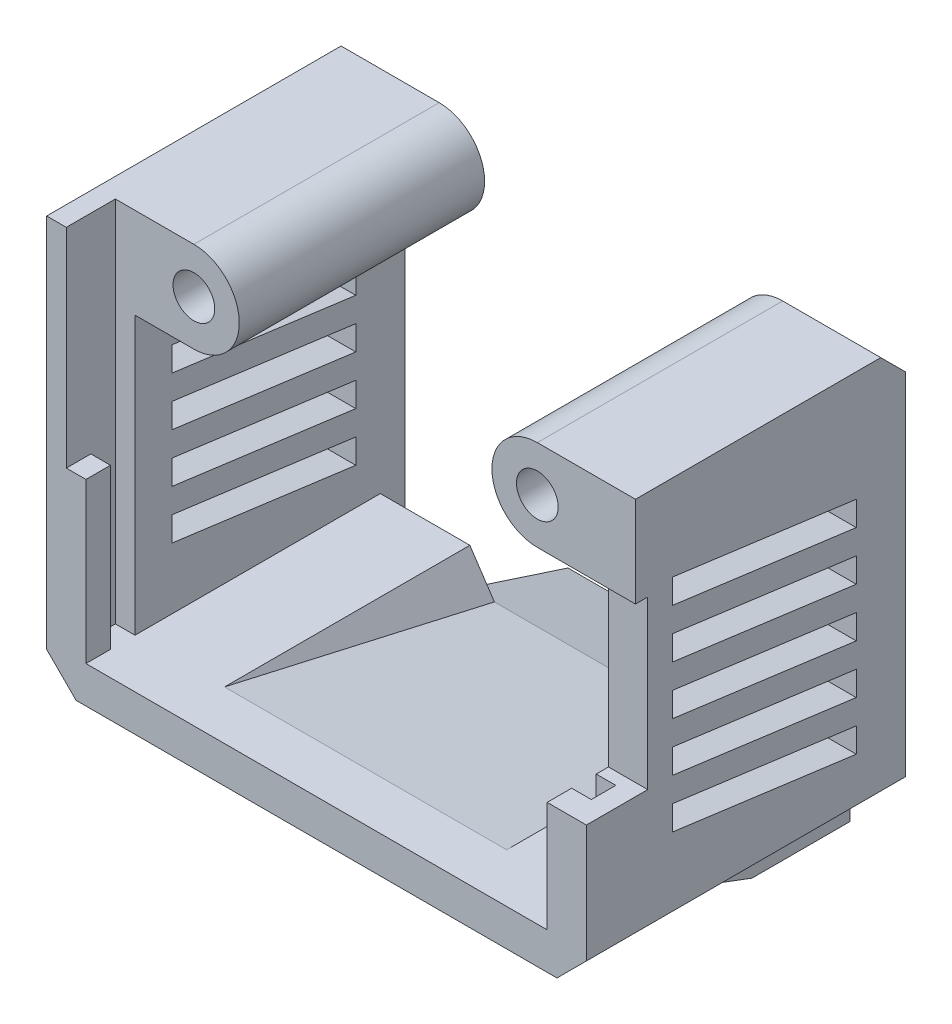
from build123d import *
from OCP.BRepFilletAPI import BRepFilletAPI_MakeChamfer

# Parameters (mm, degrees)
SKETCH_1_W           = 44
SKETCH_1_H           = 34
EXTRUDE_1_DEPTH      = 24
CUT_EXTRUDE_1_DEPTH  = 31
SKETCH_5_W           = 23
SKETCH_5_H           = 9
EXTRUDE_4_DEPTH      = 8
EXTRUDE_5_DEPTH      = 23
SKETCH_7_R           = 1.8
CUT_EXTRUDE_2_DEPTH  = 23
CUT_EXTRUDE_4_DEPTH  = 19
CUT_EXTRUDE_6_REACH  = 62.285
CHAMFER_2_SIZE       = 2
CHAMFER_2_SIZE_2     = 3
SKETCH_11_R          = 1.7
EXTRUDE_6_DEPTH      = 20
CUT_EXTRUDE_7_DEPTH  = 4
CHAMFER_3_SIZE       = 2.4
SKETCH_14_W          = 40.8
SKETCH_14_H          = 4
CUT_EXTRUDE_8_DEPTH  = 18
SKETCH_15_W          = 44
SKETCH_15_H          = 1
CUT_EXTRUDE_9_DEPTH  = 24
SKETCH_16_W          = 3.2
SKETCH_16_H          = 13.6
CUT_EXTRUDE_10_DEPTH = 5
SKETCH_17_W          = 1.6
SKETCH_17_H          = 4
CUT_EXTRUDE_11_DEPTH = 7.4
EXTRUDE_7_DEPTH      = 2
CHAMFER_4_SIZE       = 2


with BuildPart() as part:
    # Эскиз1 → Бобышка-Вытянуть1 (new body)
    with BuildSketch(Plane.XY):
        with Locations((0, 27)):
            Rectangle(SKETCH_1_W, SKETCH_1_H)
    extrude(amount=EXTRUDE_1_DEPTH)

    # Эскиз2 → Вырез-Вытянуть1 (cut)
    with BuildSketch(Plane(origin=(0, 44, 0), x_dir=(1, 0, 0), z_dir=(0, 1, 0))):
        Polygon((-18.8, 0), (18.8, 0), (18.8, -20), (20.4, -20), (20.4, -22), (18.8, -22), (18.8, -24), (-18.8, -24), (-18.8, -22), (-20.4, -22), (-20.4, -20), (-18.8, -20), align=None)
    extrude(amount=-CUT_EXTRUDE_1_DEPTH, mode=Mode.SUBTRACT)



with BuildPart() as body_2:
    # Эскиз5 → Бобышка-Вытянуть4 (new body)
    with BuildSketch(Plane(origin=(0, 0, 0), x_dir=(-1, 0, 0), z_dir=(0, 0, -1))):
        with Locations((0, 5.5)):
            Rectangle(SKETCH_5_W, SKETCH_5_H)
    extrude(amount=EXTRUDE_4_DEPTH)


with BuildPart() as part_1:
    add(part.part)

    add(body_2.part)  # Бобышка-Вытянуть5 merges body 2
    # Эскиз6 → Бобышка-Вытянуть5 (add)
    with BuildSketch(Plane(origin=(11.5, 0, 0), x_dir=(0, 0, -1), z_dir=(1, 0, 0))):
        Polygon((0, 1), (-24, 10), (0, 10), align=None)
    extrude(amount=-EXTRUDE_5_DEPTH)

    # Эскиз7 → Вырез-Вытянуть2 (cut)
    with BuildSketch(Plane.ZY.offset(11.5)):
        with Locations(Location((-4.5, 5, 0), (0, 0, 270))):
            Circle(SKETCH_7_R)
    extrude(amount=-CUT_EXTRUDE_2_DEPTH, mode=Mode.SUBTRACT)

    # Эскиз8 → Вырез-Вытянуть4 (cut)
    with BuildSketch(Plane.ZY.offset(9.5)):
        Polygon((0, 10), (20, 13), (0, 13), align=None)
    extrude(amount=-CUT_EXTRUDE_4_DEPTH, mode=Mode.SUBTRACT)

    # Вырез-Вытянуть6: up to this face of the body (flat: up to its plane)
    cut_extrude_6_end = Plane(part_1.part.faces().sort_by_distance((11.5, 6.483913321, 3.661523268))[0])
    # Эскиз9 → Вырез-Вытянуть6 (cut, up to the picked face)
    with BuildSketch(Plane.ZY.offset(11.5), mode=Mode.PRIVATE) as cut_extrude_6_sk1:
        Polygon((0, 10), (-8, 7.4), (-8, 10), align=None)
    cut_extrude_6_tool1 = split(extrude(cut_extrude_6_sk1.sketch, amount=-CUT_EXTRUDE_6_REACH, mode=Mode.PRIVATE), bisect_by=cut_extrude_6_end, keep=Keep.BOTH, mode=Mode.PRIVATE)
    add(cut_extrude_6_tool1.solids().sort_by(Axis((-11.5, 9.133333, -5.333333), (1, 0, 0)))[0], mode=Mode.SUBTRACT)

    # Фаска2
    chamfer_2_edges_1 = [part_1.edges().sort_by_distance(p)[0] for p in [
        (-9.5, 13, 10),
    ]]
    chamfer_2_side_1 = [part_1.faces().sort_by_distance(p)[0] for p in [
        (-9.54, 13, 10),
    ]]
    chamfer_2_edges_2 = [part_1.edges().sort_by_distance(p)[0] for p in [
        (9.5, 13, 10),
    ]]
    chamfer_2_side_2 = [part_1.faces().sort_by_distance(p)[0] for p in [
        (9.5, 12.96, 10),
    ]]
    chamfer_2 = BRepFilletAPI_MakeChamfer(part_1.part.solid().wrapped)
    for e in chamfer_2_edges_1:
        chamfer_2.Add(CHAMFER_2_SIZE - 0.0001, CHAMFER_2_SIZE_2 - 0.0001, e.wrapped, chamfer_2_side_1[0].wrapped)
    for e in chamfer_2_edges_2:
        chamfer_2.Add(CHAMFER_2_SIZE_2 - 0.0001, CHAMFER_2_SIZE - 0.0001, e.wrapped, chamfer_2_side_2[0].wrapped)
    add(Compound.cast(chamfer_2.Shape()), mode=Mode.REPLACE)  # a hair under: the kernel refuses the full size

    # Эскиз11 → Бобышка-Вытянуть6 (add)
    # profile 1 of 2: a face of its own
    with BuildSketch(Plane(origin=(0, 0, 0), x_dir=(-1, 0, 0), z_dir=(0, 0, -1))):
        with BuildLine():
            Line((-14, 43), (-18.8, 43))
            Line((-18.8, 43), (-18.8, 35.6))
            Line((-18.8, 35.6), (-14, 35.6))
            ThreePointArc((-14, 35.6), (-10.3, 39.3), (-14, 43))
        make_face()
        with Locations((-14, 39.3)):
            Circle(SKETCH_11_R, mode=Mode.SUBTRACT)
    # profile 2 of 2: a face of its own
    with BuildSketch(Plane(origin=(0, 0, 0), x_dir=(-1, 0, 0), z_dir=(0, 0, -1))):
        with BuildLine():
            Line((18.8, 35.6), (14, 35.6))
            ThreePointArc((14, 35.6), (10.3, 39.3), (14, 43))
            Line((14, 43), (18.8, 43))
            Line((18.8, 43), (18.8, 35.6))
        make_face()
        with Locations((14, 39.3)):
            Circle(SKETCH_11_R, mode=Mode.SUBTRACT)
    extrude(amount=-EXTRUDE_6_DEPTH)

    # Эскиз13 → Вырез-Вытянуть7 (cut)
    with BuildSketch(Plane.ZY.offset(22)):
        Polygon((2, 34), (17, 36), (17, 34), (2, 32), align=None)
        Polygon((2, 30), (17, 32), (17, 30), (2, 28), align=None)
        Polygon((2, 26), (17, 28), (17, 26), (2, 24), align=None)
        Polygon((2, 22), (17, 24), (17, 22), (2, 20), align=None)
        Polygon((2, 18), (17, 20), (17, 18), (2, 16), align=None)
    cut_extrude_7 = extrude(amount=-CUT_EXTRUDE_7_DEPTH, mode=Mode.SUBTRACT)

    # Зеркальное отражение1: Вырез-Вытянуть7 across plane
    add(cut_extrude_7.mirror(Plane(origin=(0, 0, 0), x_dir=(0, 0, 1), z_dir=(1, 0, 0))), mode=Mode.SUBTRACT)

    # Фаска3
    chamfer_3_edges = [part_1.edges().sort_by_distance(p)[0] for p in [
        (22, 10, 12),
        (-22, 10, 12),
    ]]
    chamfer(chamfer_3_edges, length=CHAMFER_3_SIZE)

    # Эскиз14 → Вырез-Вытянуть8 (cut)
    with BuildSketch(Plane(origin=(0, 44, 0), x_dir=(1, 0, 0), z_dir=(0, 1, 0))):
        with Locations((0, -22)):
            Rectangle(SKETCH_14_W, SKETCH_14_H)
    extrude(amount=-CUT_EXTRUDE_8_DEPTH, mode=Mode.SUBTRACT)

    # Эскиз15 → Вырез-Вытянуть9 (cut)
    with BuildSketch(Plane(origin=(0, 0, 0), x_dir=(-1, 0, 0), z_dir=(0, 0, -1))):
        with Locations((0, 43.5)):
            Rectangle(SKETCH_15_W, SKETCH_15_H)
    extrude(amount=-CUT_EXTRUDE_9_DEPTH, mode=Mode.SUBTRACT)

    # Эскиз16 → Вырез-Вытянуть10 (cut)
    with BuildSketch(Plane.XY.offset(24)):
        with Locations((20.4, 28.8)):
            Rectangle(SKETCH_16_W, SKETCH_16_H)
    extrude(amount=-CUT_EXTRUDE_10_DEPTH, mode=Mode.SUBTRACT)

    # Эскиз17 → Вырез-Вытянуть11 (cut)
    with BuildSketch(Plane(origin=(0, 43, 0), x_dir=(1, 0, 0), z_dir=(0, 1, 0))):
        with Locations((21.2, -22)):
            Rectangle(SKETCH_17_W, SKETCH_17_H)
    extrude(amount=-CUT_EXTRUDE_11_DEPTH, mode=Mode.SUBTRACT)

    # Эскиз18 → Бобышка-Вытянуть7 (add)
    with BuildSketch(Plane(origin=(0, 0, 0), x_dir=(-1, 0, 0), z_dir=(0, 0, -1))):
        Polygon((-22, 43), (-18.8, 43), (-18.8, 10), (-19.6, 10), (-22, 12.4), align=None)
        Polygon((22, 12.4), (19.6, 10), (18.8, 10), (18.8, 43), (22, 43), align=None)
    extrude(amount=EXTRUDE_7_DEPTH)

    # Фаска4
    chamfer_4_edges = [part_1.edges().sort_by_distance(p)[0] for p in [
        (-20.4, 43, -2),
        (20.4, 43, -2),
    ]]
    chamfer(chamfer_4_edges, length=CHAMFER_4_SIZE)


solid = part_1.part
